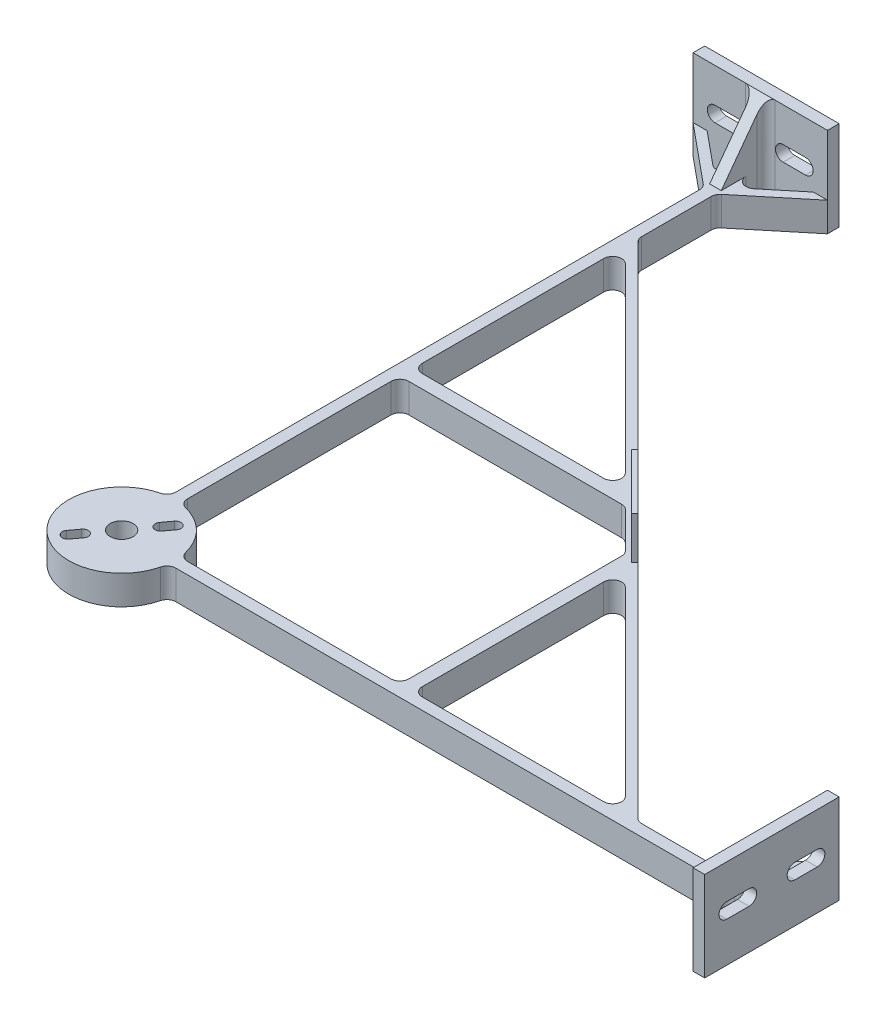
from build123d import *

# Parameters (mm, degrees)
SKETCH1_R           = 3.2385
BOSS_EXTRUDE1_DEPTH = 8.255
SKETCH3_W           = 3.302
SKETCH3_H           = 38.1
SKETCH3_W_2         = 38.1
SKETCH3_H_2         = 3.302
BOSS_EXTRUDE3_DEPTH = 25.4
BOSS_EXTRUDE4_DEPTH = 11.938
CUT_EXTRUDE1_DEPTH  = 276.581279586
SKETCH6_W           = 12.7
SKETCH6_H           = 3.302
BOSS_EXTRUDE5_DEPTH = 25.4
CUT_EXTRUDE2_DEPTH  = 25.4
SKETCH8_W           = 3.302
SKETCH8_H           = 12.7
BOSS_EXTRUDE6_DEPTH = 25.4
CUT_EXTRUDE3_DEPTH  = 25.4
FILLET1_R           = 2.54


with BuildPart() as part:
    # Sketch1 → Boss-Extrude1 (new body)
    with BuildSketch(Plane(origin=(0, 0, 0), x_dir=(1, 0, 0), z_dir=(0, 1, 0))):
        with BuildLine():
            Line((-1.651, 166.628963684), (-1.651, 14.89477744))
            ThreePointArc((-1.651, 14.89477744), (-10.596702223, -10.596702223), (14.89477744, -1.651))
            Line((14.89477744, -1.651), (166.628963684, -1.651))
            Line((166.628963684, -1.651), (180.975, -19.05))
            Line((180.975, -19.05), (180.975, -15.057345133))
            Line((180.975, -15.057345133), (169.921036316, -1.651))
            Line((169.921036316, -1.651), (180.975, -1.651))
            Line((180.975, -1.651), (180.975, 1.651))
            Line((180.975, 1.651), (169.921036316, 1.651))
            Line((169.921036316, 1.651), (180.975, 15.057345133))
            Line((180.975, 15.057345133), (180.975, 19.05))
            Line((180.975, 19.05), (166.628963684, 1.651))
            Line((166.628963684, 1.651), (144.671051224, 1.651))
            Line((144.671051224, 1.651), (1.651, 144.671051224))
            Line((1.651, 144.671051224), (1.651, 166.628963684))
            Line((1.651, 166.628963684), (19.05, 180.975))
            Line((19.05, 180.975), (15.057345133, 180.975))
            Line((15.057345133, 180.975), (1.651, 169.921036316))
            Line((1.651, 169.921036316), (1.651, 180.975))
            Line((1.651, 180.975), (-1.651, 180.975))
            Line((-1.651, 180.975), (-1.651, 169.921036316))
            Line((-1.651, 169.921036316), (-15.057345133, 180.975))
            Line((-15.057345133, 180.975), (-19.05, 180.975))
            Line((-19.05, 180.975), (-1.651, 166.628963684))
        make_face()
        with BuildLine():
            Line((-7.721732332, -7.873214705), (-5.908712478, -5.423058993))
            ThreePointArc((-5.908712478, -5.423058993), (-3.777124696, -5.104491065), (-3.458556767, -7.236078848))
            Line((-3.458556767, -7.236078848), (-5.271576621, -9.686234559))
            ThreePointArc((-5.271576621, -9.686234559), (-7.403164404, -10.004802487), (-7.721732332, -7.873214705))
        make_face(mode=Mode.SUBTRACT)
        Circle(SKETCH1_R, mode=Mode.SUBTRACT)
        with BuildLine():
            ThreePointArc((5.908712478, 5.423058993), (3.777124696, 5.104491065), (3.458556767, 7.236078848))
            Line((3.458556767, 7.236078848), (5.271576621, 9.686234559))
            ThreePointArc((5.271576621, 9.686234559), (7.403164404, 10.004802487), (7.721732332, 7.873214705))
            Line((7.721732332, 7.873214705), (5.908712478, 5.423058993))
        make_face(mode=Mode.SUBTRACT)
        with BuildLine():
            ThreePointArc((14.89477744, 1.651), (10.596702223, 10.596702223), (1.651, 14.89477744))
            Line((1.651, 14.89477744), (1.651, 77.202140867))
            Line((1.651, 77.202140867), (65.527807909, 77.202140867))
            Line((65.527807909, 77.202140867), (77.202140867, 65.527807909))
            Line((77.202140867, 65.527807909), (77.202140867, 1.651))
            Line((77.202140867, 1.651), (14.89477744, 1.651))
        make_face(mode=Mode.SUBTRACT)
        Polygon((141.078948776, 1.651), (81.012140867, 1.651), (81.012140867, 61.717807909), align=None, mode=Mode.SUBTRACT)
        Polygon((1.651, 81.012140867), (1.651, 141.078948776), (61.717807909, 81.012140867), align=None, mode=Mode.SUBTRACT)
    extrude(amount=BOSS_EXTRUDE1_DEPTH)

    # Sketch3 → Boss-Extrude3 (add)
    with BuildSketch(Plane(origin=(0, 0, 0), x_dir=(1, 0, 0), z_dir=(0, 1, 0))):
        with Locations((182.626, 0)):
            Rectangle(SKETCH3_W, SKETCH3_H)
        with Locations((0, 182.626)):
            Rectangle(SKETCH3_W_2, SKETCH3_H_2)
    extrude(amount=BOSS_EXTRUDE3_DEPTH)

    # Sketch4 → Boss-Extrude4 (add)
    with BuildSketch(Plane(origin=(0, 8.255, 0), x_dir=(1, 0, 0), z_dir=(0, 1, 0))):
        Polygon((65.258400226, 81.063650999), (64.360374613, 80.165625387), (80.165625387, 64.360374613), (81.063650999, 65.258400226), align=None)
    extrude(amount=BOSS_EXTRUDE4_DEPTH)

    # Sketch5 → Cut-Extrude1 (cut, through all)
    with BuildSketch(Plane(origin=(184.277, 0, 0), x_dir=(0, 0, -1), z_dir=(1, 0, 0))):
        with BuildLine():
            Line((-12.827, 15.63160537), (-6.477, 15.63160537))
            ThreePointArc((-6.477, 15.63160537), (-4.318, 13.47260537), (-6.477, 11.31360537))
            Line((-6.477, 11.31360537), (-12.827, 11.31360537))
            ThreePointArc((-12.827, 11.31360537), (-14.986, 13.47260537), (-12.827, 15.63160537))
        make_face()
        with BuildLine():
            Line((12.827, 15.63160537), (6.477, 15.63160537))
            ThreePointArc((6.477, 15.63160537), (4.318, 13.47260537), (6.477, 11.31360537))
            Line((6.477, 11.31360537), (12.827, 11.31360537))
            ThreePointArc((12.827, 11.31360537), (14.986, 13.47260537), (12.827, 15.63160537))
        make_face()
    cut_extrude1 = extrude(amount=-CUT_EXTRUDE1_DEPTH, mode=Mode.SUBTRACT)

    # Mirror1: Cut-Extrude1 across plane
    add(cut_extrude1.mirror(Plane(origin=(0, 0, 0), x_dir=(-0.7071067811865585, 0, 0.7071067811865367), z_dir=(0.7071067811865366, 0, 0.7071067811865585))), mode=Mode.SUBTRACT)

    # Sketch6 → Boss-Extrude5 (add)
    with BuildSketch(Plane(origin=(0, 0, 0), x_dir=(1, 0, 0), z_dir=(0, 1, 0))):
        with Locations((174.625, 0)):
            Rectangle(SKETCH6_W, SKETCH6_H)
    extrude(amount=BOSS_EXTRUDE5_DEPTH)

    # Sketch7 → Cut-Extrude2 (cut)
    with BuildSketch(Plane(origin=(0, 0, -1.651), x_dir=(-1, 0, 0), z_dir=(0, 0, -1))):
        Polygon((-180.975, 25.4), (-168.275, 8.255), (-168.275, 25.4), align=None)
    extrude(amount=-CUT_EXTRUDE2_DEPTH, mode=Mode.SUBTRACT)

    # Sketch8 → Boss-Extrude6 (add)
    with BuildSketch(Plane(origin=(0, 0, 0), x_dir=(1, 0, 0), z_dir=(0, 1, 0))):
        with Locations((0, 174.625)):
            Rectangle(SKETCH8_W, SKETCH8_H)
    extrude(amount=BOSS_EXTRUDE6_DEPTH)

    # Sketch9 → Cut-Extrude3 (cut)
    with BuildSketch(Plane(origin=(1.651, 0, 0), x_dir=(0, 0, -1), z_dir=(1, 0, 0))):
        Polygon((180.975, 25.4), (168.275, 8.255), (168.275, 25.4), align=None)
    extrude(amount=-CUT_EXTRUDE3_DEPTH, mode=Mode.SUBTRACT)

    # Fillet1
    fillet1_edges = [part.edges().sort_by_distance(p)[0] for p in [
        (180.975, 12.7, 1.651),
        (-1.651, 12.7, -180.975),
        (141.078948776, 4.1275, -1.651),
        (61.717807909, 4.1275, -81.012140867),
        (1.651, 4.1275, -141.078948776),
        (81.012140867, 4.1275, -61.717807909),
        (14.89477744, 4.1275, 1.651),
        (-1.651, 4.1275, -14.89477744),
        (180.975, 12.7, -1.651),
        (77.202140867, 4.1275, -1.651),
        (1.651, 12.7, -180.975),
        (1.651, 4.1275, -77.202140867),
        (166.628963684, 4.1275, 1.651),
        (65.527807909, 4.1275, -77.202140867),
        (-1.651, 4.1275, -166.628963684),
        (77.202140867, 4.1275, -65.527807909),
        (1.651, 4.1275, -166.628963684),
        (1.651, 4.1275, -14.89477744),
        (1.651, 4.1275, -144.671051224),
        (1.651, 4.1275, -81.012140867),
        (81.012140867, 4.1275, -1.651),
        (166.628963684, 4.1275, -1.651),
        (14.89477744, 4.1275, -1.651),
        (144.671051224, 4.1275, -1.651),
        (1.651, 4.1275, -169.921036316),
        (-1.651, 4.1275, -169.921036316),
        (169.921036316, 4.1275, -1.651),
        (169.921036316, 4.1275, 1.651),
    ]]
    fillet(fillet1_edges, radius=FILLET1_R)


solid = part.part
